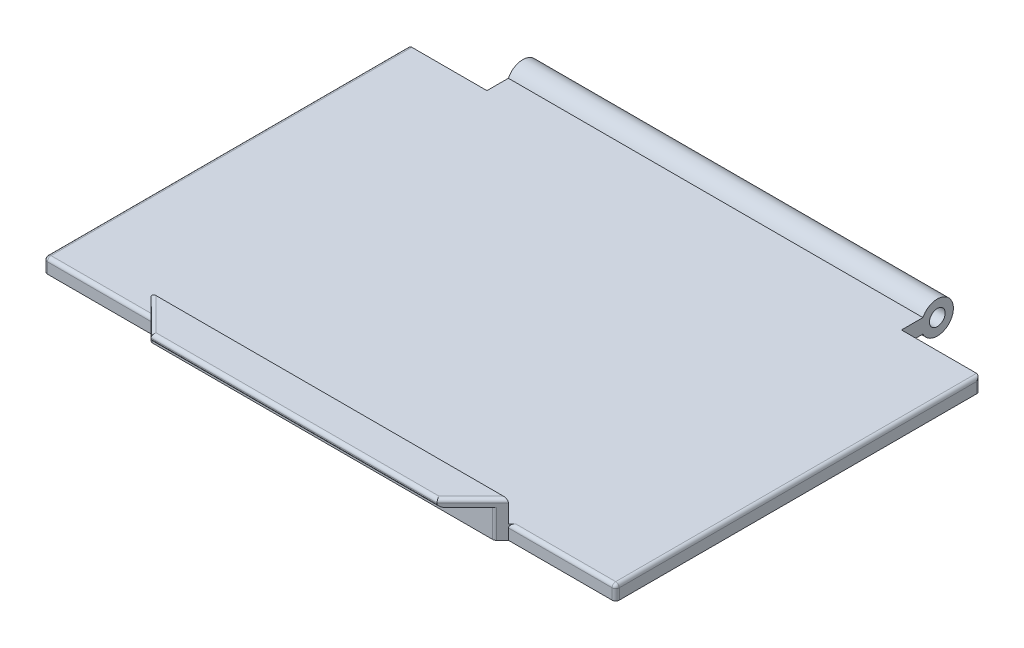
from build123d import *

# Parameters (mm, degrees)
SKETCH2_R           = 1.1
BOSS_EXTRUDE1_DEPTH = 80
CUT_EXTRUDE1_START  = 40
CUT_EXTRUDE1_DEPTH  = 11
CUT_EXTRUDE2_DEPTH  = 101.797135376
FILLET1_R           = 0.5


with BuildPart() as part:
    # Sketch2 → Boss-Extrude1 (new body)
    with BuildSketch(Plane(origin=(0, 0, 0), x_dir=(0, 0, -1), z_dir=(1, 0, 0))):
        with BuildLine():
            ThreePointArc((-2.015564437, -1), (2.25, 0), (-2.015564437, 1))
            Line((-2.015564437, 1), (-56, 1))
            Line((-56, 1), (-56, 4))
            Line((-56, 4), (-61, 4))
            Line((-61, 4), (-61, 3))
            Line((-61, 3), (-57, 3))
            Line((-57, 3), (-57, 1))
            Line((-57, 1), (-57, -1))
            Line((-57, -1), (-2.015564437, -1))
        make_face()
        Circle(SKETCH2_R, mode=Mode.SUBTRACT)
    extrude(amount=-BOSS_EXTRUDE1_DEPTH)

    # Sketch5 → Cut-Extrude1 (cut)
    with BuildSketch(Plane(origin=(-40, 0, 0), x_dir=(0, 0, -1), z_dir=(1, 0, 0)).offset(CUT_EXTRUDE1_START)):
        with BuildLine():
            Line((-2.015564437, 1), (-5.015564437, 1))
            Line((-5.015564437, 1), (-5.015564437, -1))
            Line((-5.015564437, -1), (-2.015564437, -1))
            ThreePointArc((-2.015564437, -1), (2.25, 0), (-2.015564437, 1))
        make_face()
    cut_extrude1 = extrude(amount=-CUT_EXTRUDE1_DEPTH, mode=Mode.SUBTRACT)

    # Mirror1: Cut-Extrude1 across plane
    add(cut_extrude1.mirror(Plane(origin=(-40, 0, 0), x_dir=(0, 0, 1), z_dir=(1, 0, 0))), mode=Mode.SUBTRACT)

    # Sketch6 → Cut-Extrude2 (cut, through all)
    with BuildSketch(Plane(origin=(0, 4, 0), x_dir=(1, 0, 0), z_dir=(0, 1, 0))):
        Polygon((-65, -56), (-60, -61), (-80, -61), (-80, -56), align=None)
        Polygon((-15, -56), (-20, -61), (0, -61), (0, -56), align=None)
    extrude(amount=-CUT_EXTRUDE2_DEPTH, mode=Mode.SUBTRACT)

    # Fillet1
    fillet1_edges = [part.edges().sort_by_distance(p)[0] for p in [
        (-17.5, 4, 58.5),
        (-62.5, 4, 58.5),
        (-40, 4, 61),
        (0, 0, 5.015564437),
        (0, 0, 56),
        (-80, 0, 5.015564437),
        (-80, 0, 56),
        (-40, 3, 61),
        (-16, 1, 57),
        (-64, 1, 57),
        (-72.5, 1, 56),
        (-7.5, 1, 56),
        (0, 1, 30.507782219),
        (-80, 1, 30.507782219),
    ]]
    fillet(fillet1_edges, radius=FILLET1_R - 0.0001)  # a hair under: the kernel refuses the full size


solid = part.part
